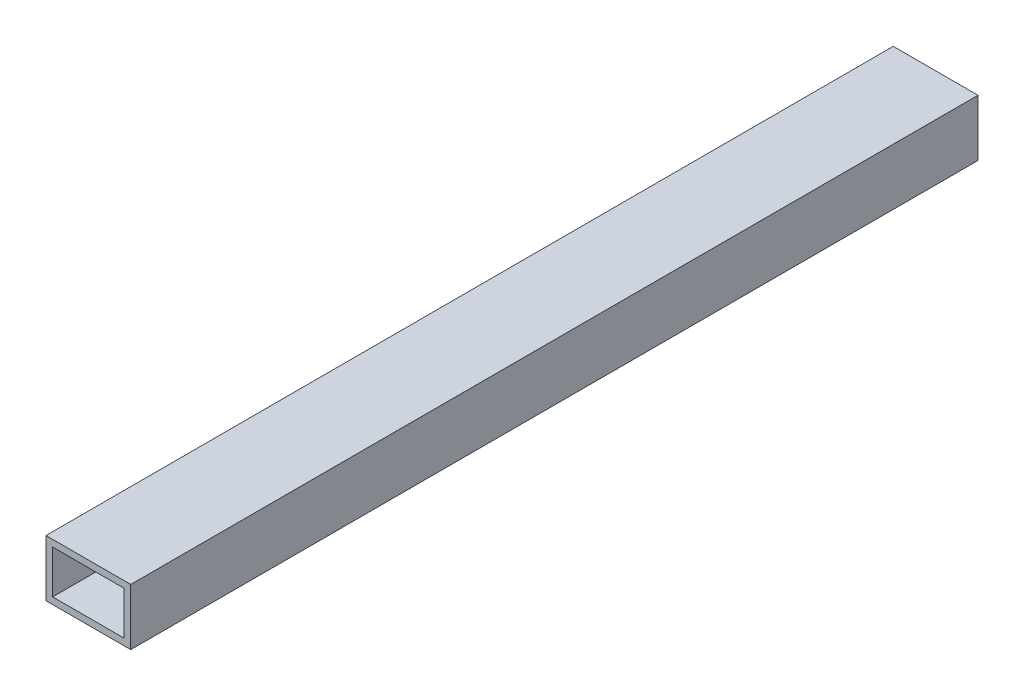
from build123d import *

# Parameters (mm, degrees)
SKETCH2_W           = 76.2
SKETCH2_H           = 50.8
SKETCH2_W_2         = 64.200000124
SKETCH2_H_2         = 38.800000124
BOSS_EXTRUDE1_DEPTH = 762


with BuildPart() as part:
    # Sketch2 → Boss-Extrude1 (new body)
    with BuildSketch(Plane.XY):
        Rectangle(SKETCH2_W, SKETCH2_H)
        Rectangle(SKETCH2_W_2, SKETCH2_H_2, mode=Mode.SUBTRACT)
    extrude(amount=BOSS_EXTRUDE1_DEPTH)


solid = part.part
